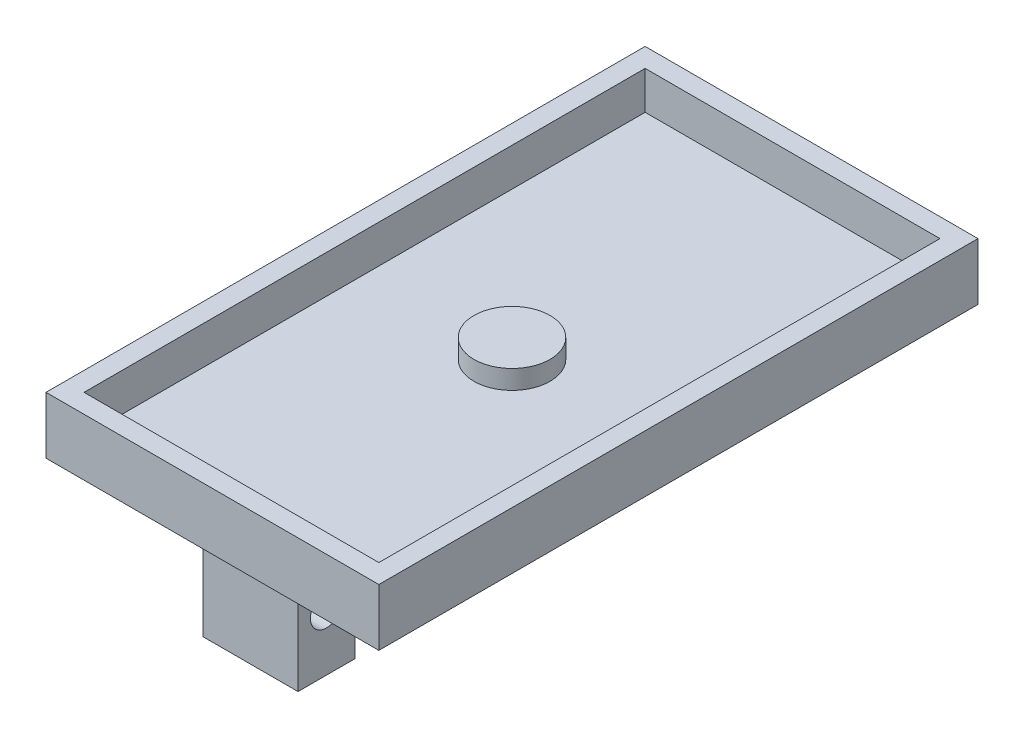
from build123d import *

# Parameters (mm, degrees)
SKETCH1_W           = 35
SKETCH1_H           = 63
BOSS_EXTRUDE1_DEPTH = 2
SKETCH2_W           = 10
SKETCH2_H           = 6
BOSS_EXTRUDE2_DEPTH = 12
SKETCH3_R           = 1.7
CUT_EXTRUDE1_DEPTH  = 10
FILLET1_R           = 4
SKETCH4_W           = 35
SKETCH4_H           = 63
SKETCH4_W_2         = 31
SKETCH4_H_2         = 59
BOSS_EXTRUDE4_DEPTH = 4
SKETCH5_R           = 4
BOSS_EXTRUDE5_DEPTH = 2


with BuildPart() as part:
    # Sketch1 → Boss-Extrude1 (new body)
    with BuildSketch(Plane(origin=(0, 0, 0), x_dir=(1, 0, 0), z_dir=(0, 1, 0))):
        Rectangle(SKETCH1_W, SKETCH1_H)
    extrude(amount=BOSS_EXTRUDE1_DEPTH)

    # Sketch2 → Boss-Extrude2 (add)
    with BuildSketch(Plane.XZ):
        with Locations((0, 24.5)):
            Rectangle(SKETCH2_W, SKETCH2_H)
        with Locations((0, -4.5)):
            Rectangle(SKETCH2_W, SKETCH2_H)
    extrude(amount=BOSS_EXTRUDE2_DEPTH)

    # Sketch3 → Cut-Extrude1 (cut)
    with BuildSketch(Plane(origin=(5, 0, 0), x_dir=(0, 0, -1), z_dir=(1, 0, 0))):
        with Locations((4.5, -6)):
            Circle(SKETCH3_R)
        with Locations((-24.5, -6)):
            Circle(SKETCH3_R)
    extrude(amount=-CUT_EXTRUDE1_DEPTH, mode=Mode.SUBTRACT)

    # Fillet1
    fillet1_edges = [part.edges().sort_by_distance(p)[0] for p in [
        (0, 0, 27.5),
        (0, 0, -7.5),
    ]]
    fillet(fillet1_edges, radius=FILLET1_R - 0.0001)  # a hair under: the kernel refuses the full size

    # Sketch4 → Boss-Extrude4 (add)
    with BuildSketch(Plane(origin=(0, 2, 0), x_dir=(1, 0, 0), z_dir=(0, 1, 0))):
        Rectangle(SKETCH4_W, SKETCH4_H)
        Rectangle(SKETCH4_W_2, SKETCH4_H_2, mode=Mode.SUBTRACT)
    extrude(amount=BOSS_EXTRUDE4_DEPTH)

    # Sketch5 → Boss-Extrude5 (add)
    with BuildSketch(Plane(origin=(0, 2, 0), x_dir=(1, 0, 0), z_dir=(0, 1, 0))):
        with Locations(Location((0, 0, 0), (0, 0, 270))):
            Circle(SKETCH5_R)
    extrude(amount=BOSS_EXTRUDE5_DEPTH)


solid = part.part
